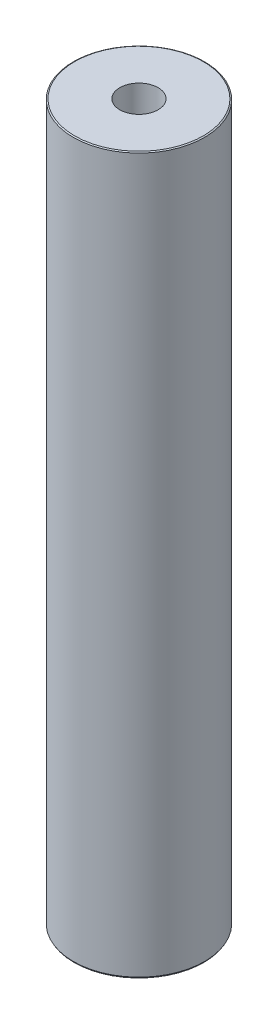
from build123d import *
from OCP.BRepFilletAPI import BRepFilletAPI_MakeChamfer

# Parameters (mm, degrees)
SKETCH1_R           = 55
BOSS_EXTRUDE1_DEPTH = 600
SKETCH2_R           = 16.09215658
CUT_EXTRUDE1_DEPTH  = 606.020660804
CHAMFER1_SIZE       = 0.605912536
CHAMFER1_SIZE2      = 1.049471297


with BuildPart() as part:
    # Sketch1 → Boss-Extrude1 (new body)
    with BuildSketch(Plane(origin=(0, 0, 0), x_dir=(1, 0, 0), z_dir=(0, 1, 0))):
        Circle(SKETCH1_R)
    extrude(amount=BOSS_EXTRUDE1_DEPTH)

    # Sketch2 → Cut-Extrude1 (cut, through all)
    with BuildSketch(Plane(origin=(0, 0, 0), x_dir=(1, 0, 0), z_dir=(0, 1, 0))):
        Circle(SKETCH2_R)
    extrude(amount=CUT_EXTRUDE1_DEPTH, mode=Mode.SUBTRACT)

    # Chamfer1: one chamfer whose edges measure the first distance from different faces: ONE call of the kernel's chamfer builder (chamfer() names one face for all edges)
    chamfer1_edges_1 = [part.edges().sort_by_distance(p)[0] for p in [
        (-55, 600, 0),
    ]]
    chamfer1_side_1 = [part.faces().sort_by_distance(p)[0] for p in [
        (-55, 300, 0),
    ]]
    chamfer1_edges_2 = [part.edges().sort_by_distance(p)[0] for p in [
        (-55, 0, 0),
    ]]
    chamfer1_side_2 = [part.faces().sort_by_distance(p)[0] for p in [
        (-53.444365081, 0, 0),
    ]]
    chamfer1 = BRepFilletAPI_MakeChamfer(part.part.solid().wrapped)
    for e in chamfer1_edges_1:
        chamfer1.Add(CHAMFER1_SIZE, CHAMFER1_SIZE2, e.wrapped, chamfer1_side_1[0].wrapped)  # the first distance lies on this face
    for e in chamfer1_edges_2:
        chamfer1.Add(CHAMFER1_SIZE, CHAMFER1_SIZE2, e.wrapped, chamfer1_side_2[0].wrapped)  # the first distance lies on this face
    add(Compound.cast(chamfer1.Shape()), mode=Mode.REPLACE)


solid = part.part
